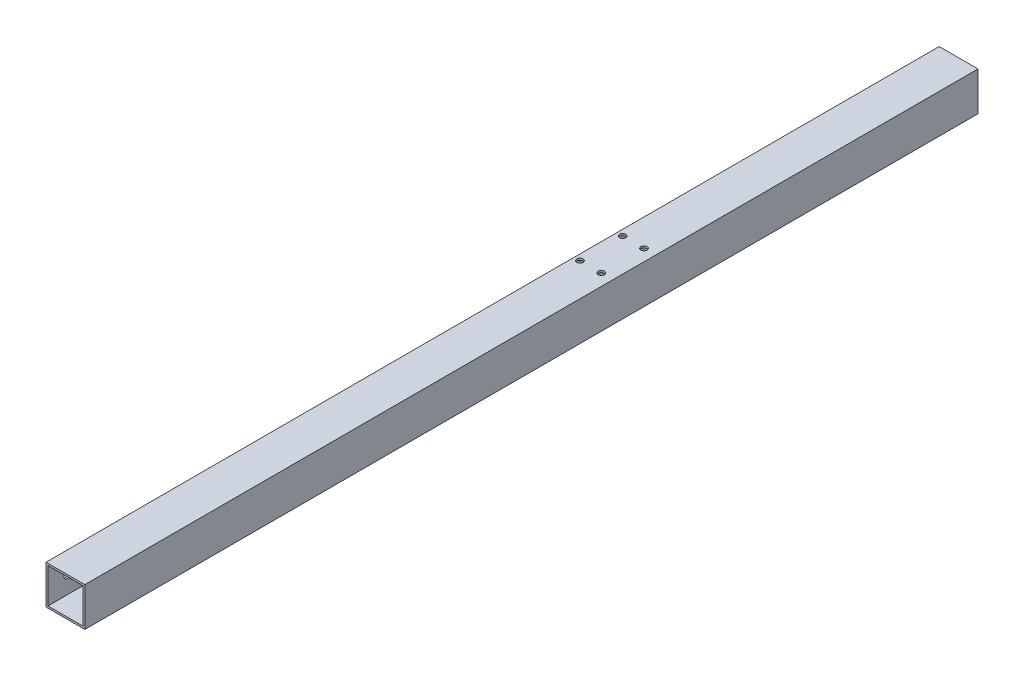
from build123d import *

# Parameters (mm, degrees)
SKETCH_1_W          = 20
SKETCH_1_H          = 20
SKETCH_1_W_2        = 18
SKETCH_1_H_2        = 18
EXTRUDE_1_DEPTH     = 460
SKETCH_2_R          = 1.8
CUT_EXTRUDE_1_DEPTH = 3
SKETCH_3_R          = 1.8
CUT_EXTRUDE_2_DEPTH = 3
SKETCH_5_R          = 1.8
CUT_EXTRUDE_3_DEPTH = 3
SKETCH_6_R          = 1.8
CUT_EXTRUDE_4_DEPTH = 10
SKETCH_7_R          = 1.6
CUT_EXTRUDE_5_DEPTH = 20


with BuildPart() as part:
    # 草图1 → 凸台-拉伸1 (new body)
    with BuildSketch(Plane.XY):
        Rectangle(SKETCH_1_W, SKETCH_1_H)
        Rectangle(SKETCH_1_W_2, SKETCH_1_H_2, mode=Mode.SUBTRACT)
    extrude(amount=EXTRUDE_1_DEPTH)

    # 草图2 → 切除-拉伸1 (cut)
    with BuildSketch(Plane.ZY.offset(10)):
        with Locations((10, 0)):
            Circle(SKETCH_2_R)
    extrude(amount=-CUT_EXTRUDE_1_DEPTH, mode=Mode.SUBTRACT)

    # 草图3 → 切除-拉伸2 (cut)
    with BuildSketch(Plane.ZY.offset(10)):
        with Locations((198, 0)):
            Circle(SKETCH_3_R)
    extrude(amount=-CUT_EXTRUDE_2_DEPTH, mode=Mode.SUBTRACT)

    # 草图5 → 切除-拉伸3 (cut)
    with BuildSketch(Plane.ZY.offset(10)):
        with Locations((450, 0)):
            Circle(SKETCH_5_R)
    extrude(amount=-CUT_EXTRUDE_3_DEPTH, mode=Mode.SUBTRACT)

    # 草图6 → 切除-拉伸4 (cut)
    with BuildSketch(Plane.ZY.offset(10)):
        with Locations((262, 0)):
            Circle(SKETCH_6_R)
    extrude(amount=-CUT_EXTRUDE_4_DEPTH, mode=Mode.SUBTRACT)

    # 草图7 → 切除-拉伸5 (cut)
    with BuildSketch(Plane(origin=(0, 10, 0), x_dir=(1, 0, 0), z_dir=(0, 1, 0))):
        with Locations((4, -166)):
            Circle(SKETCH_7_R)
        with Locations((-7, -166)):
            Circle(SKETCH_7_R)
        with Locations((4, -188)):
            Circle(SKETCH_7_R)
        with Locations((-7, -188)):
            Circle(SKETCH_7_R)
    extrude(amount=-CUT_EXTRUDE_5_DEPTH, mode=Mode.SUBTRACT)


solid = part.part
